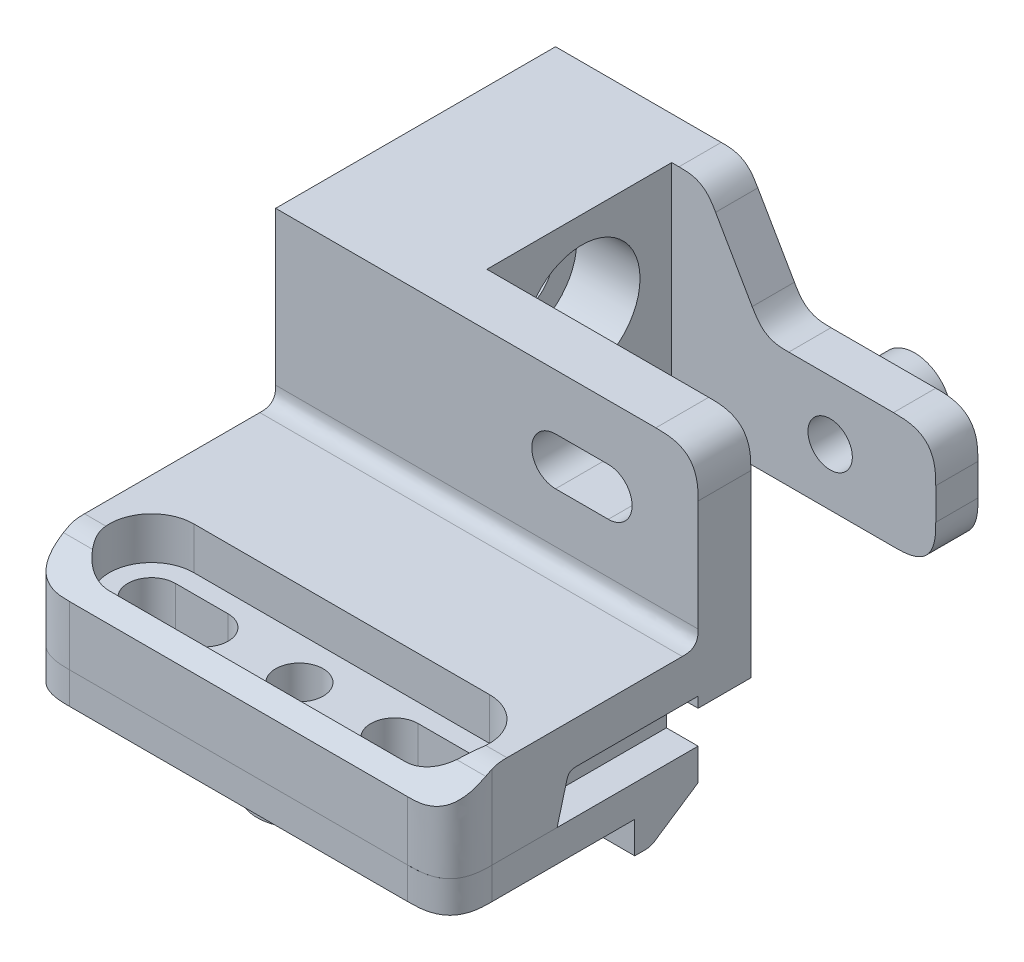
from build123d import *

# Parameters (mm, degrees)
SKETCH1_W                       = 40
SKETCH1_H                       = 35
BOSS_EXTRUDE1_DEPTH             = 3
FILLET1_SIZE                    = 4
M4X0_7_TAPPED_HOLE1_D           = 3.3
SKETCH4_W                       = 2
SKETCH4_H                       = 12.5
BOSS_EXTRUDE3_DEPTH             = 2.5
FILLET2_SIZE                    = 0.5
BOSS_EXTRUDE4_DEPTH             = 40
FILLET3_SIZE                    = 4
CBORE_FOR_M4_SHCS1_AT_2_COUNT   = 2
CBORE_FOR_M4_SHCS1_AT_2_PITCH   = 23.5
CBORE_START                     = 7.1
CBORE_SLOT_FOR_M4_SHCS1_DEPTH   = 4
CBORE_START_2                   = 3
CBORE_SLOT_FOR_M4_SHCS1_2_DEPTH = 4.1
CBORE_START_3                   = -1
CBORE_SLOT_FOR_M4_SHCS1_3_DEPTH = 5
CUT_EXTRUDE2_DEPTH              = 54.62284976
SKETCH15_W                      = 14.43925212
SKETCH15_H                      = 18.345523225
CUT_EXTRUDE3_DEPTH              = 55.297421828
BOSS_EXTRUDE5_DEPTH             = 40
BOSS_EXTRUDE6_START             = 2
SKETCH17_R                      = 4
SKETCH17_R_2                    = 1.65
BOSS_EXTRUDE6_DEPTH             = 2
SKETCH26_W                      = 40
SKETCH26_H                      = 21
BOSS_EXTRUDE9_DEPTH             = 5
BOSS_EXTRUDE10_DEPTH            = 15
FILLET19_SIZE                   = 1.5
FILLET20_SIZE                   = 4
M4_START                        = -28.5
M4_CLEARANCE_SLOT1_DEPTH        = 5
BOSS_EXTRUDE11_DEPTH            = 25
BOSS_EXTRUDE11_DEPTH_BACK       = 15
SKETCH34_W                      = 4
SKETCH34_H                      = 21
M5X0_8_TAPPED_HOLE2_AT_2_COUNT  = 2
M5X0_8_TAPPED_HOLE2_AT_2_PITCH  = 20.006249024
CUT_EXTRUDE6_DEPTH              = 4
FILLET26_SIZE                   = 4
SKETCH43_R                      = 3.5
SKETCH43_R_2                    = 2.525
BOSS_EXTRUDE12_DEPTH            = 4
SKETCH43_3_R                    = 3.5
SKETCH43_3_R_2                  = 2.525
BOSS_EXTRUDE13_DEPTH            = 2


with BuildPart() as part:
    # Sketch1 → Boss-Extrude1 (new body)
    with BuildSketch(Plane(origin=(0, 0, 0), x_dir=(1, 0, 0), z_dir=(0, 1, 0))):
        with Locations((20, 17.5)):
            Rectangle(SKETCH1_W, SKETCH1_H)
        with BuildLine():
            Line((34.5, 27.25), (28.5, 27.25))
            ThreePointArc((28.5, 27.25), (26.5, 29.25), (28.5, 31.25))
            Line((28.5, 31.25), (34.5, 31.25))
            ThreePointArc((34.5, 31.25), (36.5, 29.25), (34.5, 27.25))
        make_face(mode=Mode.SUBTRACT)
        with BuildLine():
            Line((5.5, 27.25), (11.5, 27.25))
            ThreePointArc((11.5, 27.25), (13.5, 29.25), (11.5, 31.25))
            Line((11.5, 31.25), (5.5, 31.25))
            ThreePointArc((5.5, 31.25), (3.5, 29.25), (5.5, 27.25))
        make_face(mode=Mode.SUBTRACT)
        with BuildLine():
            Line((5.5, 7.75), (11.5, 7.75))
            ThreePointArc((11.5, 7.75), (13.5, 5.75), (11.5, 3.75))
            Line((11.5, 3.75), (5.5, 3.75))
            ThreePointArc((5.5, 3.75), (3.5, 5.75), (5.5, 7.75))
        make_face(mode=Mode.SUBTRACT)
        with BuildLine():
            Line((34.5, 7.75), (28.5, 7.75))
            ThreePointArc((28.5, 7.75), (26.5, 5.75), (28.5, 3.75))
            Line((28.5, 3.75), (34.5, 3.75))
            ThreePointArc((34.5, 3.75), (36.5, 5.75), (34.5, 7.75))
        make_face(mode=Mode.SUBTRACT)
    extrude(amount=BOSS_EXTRUDE1_DEPTH)

    # Fillet1
    # a fillet whose section is not a circle: 4 mm, written as the material it takes off along each edge
    with BuildSketch(Plane(origin=(0, -10, -35), x_dir=(1, 0, 0), z_dir=(0, 1, 0)), Plane(origin=(40, -10, -35), x_dir=(0, 0, 1), z_dir=(0, 1, 0)), Plane(origin=(40, -10, 0), x_dir=(-1, 0, 0), z_dir=(0, 1, 0))) as fillet1_piece_1:
        with BuildLine():
            add(Edge.make_bspline([(FILLET1_SIZE, 0), (FILLET1_SIZE * 0.831801948466, 0), (FILLET1_SIZE * 0.663603896932, 0), (FILLET1_SIZE * 0.292893218813, -FILLET1_SIZE * 0.0716919198361), (FILLET1_SIZE * 0.0716919198361, -FILLET1_SIZE * 0.292893218813), (0, -FILLET1_SIZE * 0.663603896932), (0, -FILLET1_SIZE * 0.831801948466), (0, -FILLET1_SIZE)], knots=[0, 0, 0, 0, 0, 0, 0.5, 0.5, 1, 1, 1, 1, 1, 1], degree=5))
            Line((0, -FILLET1_SIZE), (0, 0))
            Line((0, 0), (FILLET1_SIZE, 0))
        make_face()
    extrude(amount=23, mode=Mode.SUBTRACT)
    with BuildSketch(Plane(origin=(0, -10, 0), x_dir=(1, 0, 0), z_dir=(0, 1, 0))) as fillet1_piece_2:
        with BuildLine():
            add(Edge.make_bspline([(FILLET1_SIZE, 0), (FILLET1_SIZE * 0.831801948466, 0), (FILLET1_SIZE * 0.663603896932, 0), (FILLET1_SIZE * 0.292893218813, FILLET1_SIZE * 0.0716919198361), (FILLET1_SIZE * 0.0716919198361, FILLET1_SIZE * 0.292893218813), (0, FILLET1_SIZE * 0.663603896932), (0, FILLET1_SIZE * 0.831801948466), (0, FILLET1_SIZE)], knots=[0, 0, 0, 0, 0, 0, 0.5, 0.5, 1, 1, 1, 1, 1, 1], degree=5))
            Line((0, FILLET1_SIZE), (0, 0))
            Line((0, 0), (FILLET1_SIZE, 0))
        make_face()
    extrude(amount=23, mode=Mode.SUBTRACT)

    # M4x0.7 Tapped Hole1 (through all)
    with Locations(Plane(origin=(0, 3, 0), x_dir=(1, 0, 0), z_dir=(0, 1, 0))):
        with Locations((20, 29.25), (20, 5.75)):
            Hole(M4X0_7_TAPPED_HOLE1_D / 2)

    # Sketch4 → Boss-Extrude3 (add)
    with BuildSketch(Plane(origin=(0, 3, 0), x_dir=(1, 0, 0), z_dir=(0, 1, 0))):
        with Locations((1, 17.5)):
            Rectangle(SKETCH4_W, SKETCH4_H)
        with Locations((6.833333333, 17.5)):
            Rectangle(SKETCH4_W, SKETCH4_H)
        with Locations((12.666666667, 17.5)):
            Rectangle(SKETCH4_W, SKETCH4_H)
        with Locations((18.5, 17.5)):
            Rectangle(SKETCH4_W, SKETCH4_H)
        with Locations((24.333333333, 17.5)):
            Rectangle(SKETCH4_W, SKETCH4_H)
        with Locations((30.166666667, 17.5)):
            Rectangle(SKETCH4_W, SKETCH4_H)
        with Locations((36, 17.5)):
            Rectangle(SKETCH4_W, SKETCH4_H)
    extrude(amount=BOSS_EXTRUDE3_DEPTH)

    # Fillet2
    # a fillet whose section is not a circle: 0.5 mm, written as the material it adds along each edge
    with BuildSketch(Plane(origin=(2, 3, -11.25), x_dir=(0, 0, 1), z_dir=(-1, 0, 0)), Plane(origin=(0, 3, -23.75), x_dir=(0, 0, -1), z_dir=(1, 0, 0))) as fillet2_piece_1:
        with BuildLine():
            add(Edge.make_bspline([(FILLET2_SIZE, 0), (FILLET2_SIZE * 0.831801948466, 0), (FILLET2_SIZE * 0.663603896932, 0), (FILLET2_SIZE * 0.292893218813, FILLET2_SIZE * 0.0716919198361), (FILLET2_SIZE * 0.0716919198361, FILLET2_SIZE * 0.292893218813), (0, FILLET2_SIZE * 0.663603896932), (0, FILLET2_SIZE * 0.831801948466), (0, FILLET2_SIZE)], knots=[0, 0, 0, 0, 0, 0, 0.5, 0.5, 1, 1, 1, 1, 1, 1], degree=5))
            Line((0, FILLET2_SIZE), (0, 0))
            Line((0, 0), (FILLET2_SIZE, 0))
        make_face()
    extrude(amount=2)
    with BuildSketch(Plane(origin=(7.833333333, 3, -23.75), x_dir=(0, 0, -1), z_dir=(-1, 0, 0)), Plane(origin=(5.833333333, 3, -11.25), x_dir=(0, 0, 1), z_dir=(1, 0, 0)), Plane(origin=(13.666666667, 3, -23.75), x_dir=(0, 0, -1), z_dir=(-1, 0, 0)), Plane(origin=(11.666666667, 3, -11.25), x_dir=(0, 0, 1), z_dir=(1, 0, 0)), Plane(origin=(17.5, 3, -11.25), x_dir=(0, 0, 1), z_dir=(1, 0, 0)), Plane(origin=(25.333333333, 3, -23.75), x_dir=(0, 0, -1), z_dir=(-1, 0, 0)), Plane(origin=(23.333333333, 3, -11.25), x_dir=(0, 0, 1), z_dir=(1, 0, 0)), Plane(origin=(31.166666667, 3, -23.75), x_dir=(0, 0, -1), z_dir=(-1, 0, 0)), Plane(origin=(29.166666667, 3, -11.25), x_dir=(0, 0, 1), z_dir=(1, 0, 0)), Plane(origin=(37, 3, -23.75), x_dir=(0, 0, -1), z_dir=(-1, 0, 0)), Plane(origin=(35, 3, -11.25), x_dir=(0, 0, 1), z_dir=(1, 0, 0)), Plane(origin=(19.5, 3, -23.75), x_dir=(0, 0, -1), z_dir=(-1, 0, 0))) as fillet2_piece_2:
        with BuildLine():
            add(Edge.make_bspline([(FILLET2_SIZE, 0), (FILLET2_SIZE * 0.831801948466, 0), (FILLET2_SIZE * 0.663603896932, 0), (FILLET2_SIZE * 0.292893218813, -FILLET2_SIZE * 0.0716919198361), (FILLET2_SIZE * 0.0716919198361, -FILLET2_SIZE * 0.292893218813), (0, -FILLET2_SIZE * 0.663603896932), (0, -FILLET2_SIZE * 0.831801948466), (0, -FILLET2_SIZE)], knots=[0, 0, 0, 0, 0, 0, 0.5, 0.5, 1, 1, 1, 1, 1, 1], degree=5))
            Line((0, -FILLET2_SIZE), (0, 0))
            Line((0, 0), (FILLET2_SIZE, 0))
        make_face()
    extrude(amount=2)
    # a fillet whose section is not a circle: 0.5 mm, written as the material it takes off along each edge
    with BuildSketch(Plane(origin=(-1.25, 5.5, -23.75), x_dir=(0, 0, 1), z_dir=(1, 0, 0)), Plane(origin=(4.583333333, 5.5, -11.25), x_dir=(0, -1, 0), z_dir=(1, 0, 0)), Plane(origin=(10.416666667, 5.5, -11.25), x_dir=(0, -1, 0), z_dir=(1, 0, 0)), Plane(origin=(16.25, 5.5, -11.25), x_dir=(0, -1, 0), z_dir=(1, 0, 0)), Plane(origin=(22.083333333, 5.5, -11.25), x_dir=(0, -1, 0), z_dir=(1, 0, 0)), Plane(origin=(27.916666667, 5.5, -11.25), x_dir=(0, -1, 0), z_dir=(1, 0, 0)), Plane(origin=(33.75, 5.5, -11.25), x_dir=(0, -1, 0), z_dir=(1, 0, 0))) as fillet2_2_piece_1:
        with BuildLine():
            add(Edge.make_bspline([(FILLET2_SIZE, 0), (FILLET2_SIZE * 0.831801948466, 0), (FILLET2_SIZE * 0.663603896932, 0), (FILLET2_SIZE * 0.292893218813, FILLET2_SIZE * 0.0716919198361), (FILLET2_SIZE * 0.0716919198361, FILLET2_SIZE * 0.292893218813), (0, FILLET2_SIZE * 0.663603896932), (0, FILLET2_SIZE * 0.831801948466), (0, FILLET2_SIZE)], knots=[0, 0, 0, 0, 0, 0, 0.5, 0.5, 1, 1, 1, 1, 1, 1], degree=5))
            Line((0, FILLET2_SIZE), (0, 0))
            Line((0, 0), (FILLET2_SIZE, 0))
        make_face()
    extrude(amount=4.5, mode=Mode.SUBTRACT)
    with BuildSketch(Plane(origin=(3.25, 5.5, -11.25), x_dir=(0, -1, 0), z_dir=(-1, 0, 0)), Plane(origin=(9.083333333, 5.5, -23.75), x_dir=(0, 0, 1), z_dir=(-1, 0, 0)), Plane(origin=(14.916666667, 5.5, -23.75), x_dir=(0, 0, 1), z_dir=(-1, 0, 0)), Plane(origin=(26.583333333, 5.5, -23.75), x_dir=(0, 0, 1), z_dir=(-1, 0, 0)), Plane(origin=(32.416666667, 5.5, -23.75), x_dir=(0, 0, 1), z_dir=(-1, 0, 0)), Plane(origin=(38.25, 5.5, -23.75), x_dir=(0, 0, 1), z_dir=(-1, 0, 0)), Plane(origin=(20.75, 5.5, -23.75), x_dir=(0, 0, 1), z_dir=(-1, 0, 0))) as fillet2_2_piece_2:
        with BuildLine():
            add(Edge.make_bspline([(FILLET2_SIZE, 0), (FILLET2_SIZE * 0.831801948466, 0), (FILLET2_SIZE * 0.663603896932, 0), (FILLET2_SIZE * 0.292893218813, -FILLET2_SIZE * 0.0716919198361), (FILLET2_SIZE * 0.0716919198361, -FILLET2_SIZE * 0.292893218813), (0, -FILLET2_SIZE * 0.663603896932), (0, -FILLET2_SIZE * 0.831801948466), (0, -FILLET2_SIZE)], knots=[0, 0, 0, 0, 0, 0, 0.5, 0.5, 1, 1, 1, 1, 1, 1], degree=5))
            Line((0, -FILLET2_SIZE), (0, 0))
            Line((0, 0), (FILLET2_SIZE, 0))
        make_face()
    extrude(amount=4.5, mode=Mode.SUBTRACT)

    # CBORE SLOT for M4 SHCS1 3 outline → CBORE SLOT for M4 SHCS1 3 (cut)
    with BuildSketch(Plane(origin=(0, 0, 0), x_dir=(1, 0, 0), z_dir=(0, 1, 0)).offset(CBORE_START_3)):
        with BuildLine():
            Line((34, 8), (29, 8))
            ThreePointArc((29, 8), (28.310590421, 7.891778334), (27.6875, 7.57752394))
            ThreePointArc((27.6875, 7.57752394), (28.084697628, 7.706405873), (28.5, 7.75))
            Line((28.5, 7.75), (34.5, 7.75))
            ThreePointArc((34.5, 7.75), (34.915302372, 7.706405873), (35.3125, 7.57752394))
            ThreePointArc((35.3125, 7.57752394), (34.689409579, 7.891778334), (34, 8))
        make_face()
        with BuildLine():
            ThreePointArc((28.5, 3.75), (28.084697628, 3.793594127), (27.6875, 3.92247606))
            ThreePointArc((27.6875, 3.92247606), (28.310590421, 3.608221666), (29, 3.5))
            Line((29, 3.5), (34, 3.5))
            ThreePointArc((34, 3.5), (34.689409579, 3.608221666), (35.3125, 3.92247606))
            ThreePointArc((35.3125, 3.92247606), (34.915302372, 3.793594127), (34.5, 3.75))
            Line((34.5, 3.75), (28.5, 3.75))
        make_face()
        with BuildLine():
            ThreePointArc((12.3125, 7.57752394), (11.689409579, 7.891778334), (11, 8))
            Line((11, 8), (6, 8))
            ThreePointArc((6, 8), (5.310590421, 7.891778334), (4.6875, 7.57752394))
            ThreePointArc((4.6875, 7.57752394), (5.084697628, 7.706405873), (5.5, 7.75))
            Line((5.5, 7.75), (11.5, 7.75))
            ThreePointArc((11.5, 7.75), (11.915302372, 7.706405873), (12.3125, 7.57752394))
        make_face()
        with BuildLine():
            ThreePointArc((11, 3.5), (11.689409579, 3.608221666), (12.3125, 3.92247606))
            ThreePointArc((12.3125, 3.92247606), (11.915302372, 3.793594127), (11.5, 3.75))
            Line((11.5, 3.75), (5.5, 3.75))
            ThreePointArc((5.5, 3.75), (5.084697628, 3.793594127), (4.6875, 3.92247606))
            ThreePointArc((4.6875, 3.92247606), (5.310590421, 3.608221666), (6, 3.5))
            Line((6, 3.5), (11, 3.5))
        make_face()
        with BuildLine():
            Line((34, 31.5), (29, 31.5))
            ThreePointArc((29, 31.5), (28.310590421, 31.391778334), (27.6875, 31.07752394))
            ThreePointArc((27.6875, 31.07752394), (28.084697628, 31.206405873), (28.5, 31.25))
            Line((28.5, 31.25), (34.5, 31.25))
            ThreePointArc((34.5, 31.25), (34.915302372, 31.206405873), (35.3125, 31.07752394))
            ThreePointArc((35.3125, 31.07752394), (34.689409579, 31.391778334), (34, 31.5))
        make_face()
        with BuildLine():
            ThreePointArc((28.5, 27.25), (28.084697628, 27.293594127), (27.6875, 27.42247606))
            ThreePointArc((27.6875, 27.42247606), (28.310590421, 27.108221666), (29, 27))
            Line((29, 27), (34, 27))
            ThreePointArc((34, 27), (34.689409579, 27.108221666), (35.3125, 27.42247606))
            ThreePointArc((35.3125, 27.42247606), (34.915302372, 27.293594127), (34.5, 27.25))
            Line((34.5, 27.25), (28.5, 27.25))
        make_face()
        with BuildLine():
            ThreePointArc((12.3125, 31.07752394), (11.689409579, 31.391778334), (11, 31.5))
            Line((11, 31.5), (6, 31.5))
            ThreePointArc((6, 31.5), (5.310590421, 31.391778334), (4.6875, 31.07752394))
            ThreePointArc((4.6875, 31.07752394), (5.084697628, 31.206405873), (5.5, 31.25))
            Line((5.5, 31.25), (11.5, 31.25))
            ThreePointArc((11.5, 31.25), (11.915302372, 31.206405873), (12.3125, 31.07752394))
        make_face()
        with BuildLine():
            ThreePointArc((11, 27), (11.689409579, 27.108221666), (12.3125, 27.42247606))
            ThreePointArc((12.3125, 27.42247606), (11.915302372, 27.293594127), (11.5, 27.25))
            Line((11.5, 27.25), (5.5, 27.25))
            ThreePointArc((5.5, 27.25), (5.084697628, 27.293594127), (4.6875, 27.42247606))
            ThreePointArc((4.6875, 27.42247606), (5.310590421, 27.108221666), (6, 27))
            Line((6, 27), (11, 27))
        make_face()
    extrude(amount=CBORE_SLOT_FOR_M4_SHCS1_3_DEPTH, mode=Mode.SUBTRACT)


with BuildPart() as body_2:
    # Sketch7 → Boss-Extrude4 (new body)
    with BuildSketch(Plane.ZY):
        Polygon((-11.25, 7.1), (-23.75, 7.1), (-24.848591689, 3), (-35, 3), (-35, 8.6), (-30.669872981, 11.1), (-4.330127019, 11.1), (0, 8.6), (0, 3), (-10.151408311, 3), align=None)
    extrude(amount=-BOSS_EXTRUDE4_DEPTH)

    # Fillet3
    # a fillet whose section is not a circle: 4 mm, written as the material it takes off along each edge
    with BuildSketch(Plane(origin=(0, -7, -35), x_dir=(1, 0, 0), z_dir=(0, 1, 0)), Plane(origin=(0, 18.6, 0), x_dir=(1, 0, 0), z_dir=(0, -1, 0))) as fillet3_piece_1:
        with BuildLine():
            add(Edge.make_bspline([(FILLET3_SIZE, 0), (FILLET3_SIZE * 0.831801948466, 0), (FILLET3_SIZE * 0.663603896932, 0), (FILLET3_SIZE * 0.292893218813, -FILLET3_SIZE * 0.0716919198361), (FILLET3_SIZE * 0.0716919198361, -FILLET3_SIZE * 0.292893218813), (0, -FILLET3_SIZE * 0.663603896932), (0, -FILLET3_SIZE * 0.831801948466), (0, -FILLET3_SIZE)], knots=[0, 0, 0, 0, 0, 0, 0.5, 0.5, 1, 1, 1, 1, 1, 1], degree=5))
            Line((0, -FILLET3_SIZE), (0, 0))
            Line((0, 0), (FILLET3_SIZE, 0))
        make_face()
    extrude(amount=25.6, mode=Mode.SUBTRACT)
    with BuildSketch(Plane(origin=(40, 18.6, 0), x_dir=(-1, 0, 0), z_dir=(0, -1, 0)), Plane(origin=(40, -7, -35), x_dir=(-1, 0, 0), z_dir=(0, 1, 0))) as fillet3_piece_2:
        with BuildLine():
            add(Edge.make_bspline([(FILLET3_SIZE, 0), (FILLET3_SIZE * 0.831801948466, 0), (FILLET3_SIZE * 0.663603896932, 0), (FILLET3_SIZE * 0.292893218813, FILLET3_SIZE * 0.0716919198361), (FILLET3_SIZE * 0.0716919198361, FILLET3_SIZE * 0.292893218813), (0, FILLET3_SIZE * 0.663603896932), (0, FILLET3_SIZE * 0.831801948466), (0, FILLET3_SIZE)], knots=[0, 0, 0, 0, 0, 0, 0.5, 0.5, 1, 1, 1, 1, 1, 1], degree=5))
            Line((0, FILLET3_SIZE), (0, 0))
            Line((0, 0), (FILLET3_SIZE, 0))
        make_face()
    extrude(amount=25.6, mode=Mode.SUBTRACT)

    # Fillet4
    # a fillet whose section is not a circle: 4 mm, written as the material it takes off along each edge
    with BuildSketch(Plane(origin=(-2.679491924, 11.1, -4.330127019), x_dir=(0, -0.4999999999999976, 0.8660254037844402), z_dir=(1, 0, 0)), Plane(origin=(-2.679491924, 11.1, -30.669872981), x_dir=(0, 0, 1), z_dir=(1, 0, 0))) as fillet4_piece_1:
        with BuildLine():
            add(Edge.make_bspline([(1.07179677, 0), (0.872924764, 0), (0.674052759, 0), (0.23110286, 0.023954568), (-0.188163664, 0.136296695), (-0.583746812, 0.337026379), (-0.755975021, 0.436462382), (-0.92820323, 0.535898385)], knots=[0, 0, 0, 0, 0, 0, 0.5, 0.5, 1, 1, 1, 1, 1, 1], degree=5))
            Line((-0.92820323, 0.535898385), (0, 0))
            Line((0, 0), (1.07179677, 0))
        make_face()
    extrude(amount=45.358983849, mode=Mode.SUBTRACT)

    # Sketch9 → CBORE for M4 SHCS1 (revolve, cut)
    with BuildSketch(Plane(origin=(20, 11.1, -5.75), x_dir=(0, 0, 1), z_dir=(1, 0, 0))):
        Polygon((0, 0), (0, 11.15), (2.25, 11.15), (2.25, 4), (4, 4), (4, 0), align=None)
    cbore_for_m4_shcs1 = revolve(axis=Axis((20, 17.45, -5.75), (0, -1, 0)), mode=Mode.SUBTRACT)

    # CBORE for M4 SHCS1 at 2: CBORE for M4 SHCS1 ×2
    with Locations(*[(0, 0, -i * CBORE_FOR_M4_SHCS1_AT_2_PITCH) for i in range(1, CBORE_FOR_M4_SHCS1_AT_2_COUNT)]):
        add(cbore_for_m4_shcs1, mode=Mode.SUBTRACT)

    # CBORE SLOT for M4 SHCS1: read off the stored shape, not the designer's step
    # CBORE SLOT for M4 SHCS1 outline → CBORE SLOT for M4 SHCS1 (cut)
    with BuildSketch(Plane(origin=(0, 0, 0), x_dir=(1, 0, 0), z_dir=(0, 1, 0)).offset(CBORE_START)):
        with BuildLine():
            Line((29, 1.75), (34, 1.75))
            ThreePointArc((34, 1.75), (38, 5.75), (34, 9.75))
            Line((34, 9.75), (29, 9.75))
            ThreePointArc((29, 9.75), (25, 5.75), (29, 1.75))
        make_face()
        with BuildLine():
            ThreePointArc((11, 1.75), (15, 5.75), (11, 9.75))
            Line((11, 9.75), (6, 9.75))
            ThreePointArc((6, 9.75), (2, 5.75), (6, 1.75))
            Line((6, 1.75), (11, 1.75))
        make_face()
        with BuildLine():
            Line((29, 25.25), (34, 25.25))
            ThreePointArc((34, 25.25), (38, 29.25), (34, 33.25))
            Line((34, 33.25), (29, 33.25))
            ThreePointArc((29, 33.25), (25, 29.25), (29, 25.25))
        make_face()
        with BuildLine():
            ThreePointArc((11, 25.25), (15, 29.25), (11, 33.25))
            Line((11, 33.25), (6, 33.25))
            ThreePointArc((6, 33.25), (2, 29.25), (6, 25.25))
            Line((6, 25.25), (11, 25.25))
        make_face()
    extrude(amount=CBORE_SLOT_FOR_M4_SHCS1_DEPTH, mode=Mode.SUBTRACT)

    # CBORE SLOT for M4 SHCS1 2 outline → CBORE SLOT for M4 SHCS1 2 (cut)
    with BuildSketch(Plane(origin=(0, 0, 0), x_dir=(1, 0, 0), z_dir=(0, 1, 0)).offset(CBORE_START_2)):
        with BuildLine():
            Line((29, 3.5), (34, 3.5))
            ThreePointArc((34, 3.5), (36.25, 5.75), (34, 8))
            Line((34, 8), (29, 8))
            ThreePointArc((29, 8), (26.75, 5.75), (29, 3.5))
        make_face()
        with BuildLine():
            ThreePointArc((11, 3.5), (13.25, 5.75), (11, 8))
            Line((11, 8), (6, 8))
            ThreePointArc((6, 8), (3.75, 5.75), (6, 3.5))
            Line((6, 3.5), (11, 3.5))
        make_face()
        with BuildLine():
            Line((29, 27), (34, 27))
            ThreePointArc((34, 27), (36.25, 29.25), (34, 31.5))
            Line((34, 31.5), (29, 31.5))
            ThreePointArc((29, 31.5), (26.75, 29.25), (29, 27))
        make_face()
        with BuildLine():
            ThreePointArc((11, 27), (13.25, 29.25), (11, 31.5))
            Line((11, 31.5), (6, 31.5))
            ThreePointArc((6, 31.5), (3.75, 29.25), (6, 27))
            Line((6, 27), (11, 27))
        make_face()
    extrude(amount=CBORE_SLOT_FOR_M4_SHCS1_2_DEPTH, mode=Mode.SUBTRACT)

    # Sketch14 → Cut-Extrude2 (cut, through all)
    with BuildSketch(Plane(origin=(0, 7.1, 0), x_dir=(1, 0, 0), z_dir=(0, 1, 0))):
        with BuildLine():
            Line((6, 9.75), (34, 9.75))
            ThreePointArc((34, 9.75), (38, 5.75), (34, 1.75))
            Line((34, 1.75), (6, 1.75))
            ThreePointArc((6, 1.75), (2, 5.75), (6, 9.75))
        make_face()
        with BuildLine():
            Line((6, 25.25), (34, 25.25))
            ThreePointArc((34, 25.25), (38, 29.25), (34, 33.25))
            Line((34, 33.25), (6, 33.25))
            ThreePointArc((6, 33.25), (2, 29.25), (6, 25.25))
        make_face()
    extrude(amount=CUT_EXTRUDE2_DEPTH, mode=Mode.SUBTRACT)


with BuildPart() as cut_extrude3_tool:
    # Sketch15 → Cut-Extrude3 (new, through all)
    with BuildSketch(Plane(origin=(40, 0, 0), x_dir=(0, 0, -1), z_dir=(1, 0, 0))):
        with Locations((30.71962606, 7.319913379)):
            Rectangle(SKETCH15_W, SKETCH15_H)
    extrude(amount=-CUT_EXTRUDE3_DEPTH)


with BuildPart() as part_1:
    add(part.part)

    # Cut-Extrude3: cut by cut_extrude3_tool
    add(cut_extrude3_tool.part, mode=Mode.SUBTRACT)

    # Sketch16 → Boss-Extrude5 (add)
    with BuildSketch(Plane(origin=(40, 0, 0), x_dir=(0, 0, -1), z_dir=(1, 0, 0))):
        Polygon((17.5, -3), (17.5, 0), (23.5, 0), (19, -3), align=None)
    extrude(amount=-BOSS_EXTRUDE5_DEPTH)

    # Fillet9
    # a fillet whose section is not a circle: 2 mm, written as the material it takes off along each edge
    with BuildSketch(Plane(origin=(41.513878189, -3, -19), x_dir=(0, 0.5547001962264975, -0.8320502943369983), z_dir=(-1, 0, 0))) as fillet9_piece_1:
        with BuildLine():
            add(Edge.make_bspline([(0.605551275, 0), (0.493503997, 0), (0.381456719, 0), (0.131780037, -0.015284575), (-0.101169262, -0.085815947), (-0.317391175, -0.211594117), (-0.410620146, -0.273746764), (-0.503849117, -0.335899411)], knots=[0, 0, 0, 0, 0, 0, 0.5, 0.5, 1, 1, 1, 1, 1, 1], degree=5))
            Line((-0.503849117, -0.335899411), (0, 0))
            Line((0, 0), (0.605551275, 0))
        make_face()
    extrude(amount=43.027756377, mode=Mode.SUBTRACT)

    # Sketch17 → Boss-Extrude6 (add)
    with BuildSketch(Plane.XZ.offset(BOSS_EXTRUDE6_START)):
        with Locations(Location((20, -5.75, 0), (0, 0, 270))):
            Circle(SKETCH17_R)
        with Locations(Location((20, -5.75, 0), (0, 0, 90))):
            Circle(SKETCH17_R_2, mode=Mode.SUBTRACT)
    extrude(amount=-BOSS_EXTRUDE6_DEPTH)


with BuildPart() as body_2_1:
    add(body_2.part)

    # Cut-Extrude3: cut by cut_extrude3_tool
    add(cut_extrude3_tool.part, mode=Mode.SUBTRACT)

    # Fillet6
    # a fillet whose section is not a circle: 1 mm, written as the material it adds along each edge
    with BuildSketch(Plane(origin=(0, 7.1, -11.25), x_dir=(0, 0, -1), z_dir=(1, 0, 0))) as fillet6_piece_1:
        with BuildLine():
            add(Edge.make_bspline([(0.767326988, 0), (0.633400256, 0), (0.499473523, 0), (0.201656646, -0.045828534), (-0.007925615, -0.20664666), (-0.12927326, -0.482454376), (-0.163936049, -0.611817665), (-0.198598838, -0.741180955)], knots=[0, 0, 0, 0, 0, 0, 0.5, 0.5, 1, 1, 1, 1, 1, 1], degree=5))
            Line((-0.198598838, -0.741180955), (0, 0))
            Line((0, 0), (0.767326988, 0))
        make_face()
    extrude(amount=40)

    # Sketch26 → Boss-Extrude9 (add)
    with BuildSketch(Plane(origin=(0, 0, -23.5), x_dir=(-1, 0, 0), z_dir=(0, 0, -1))):
        with Locations((-20, 16.6)):
            Rectangle(SKETCH26_W, SKETCH26_H)
    extrude(amount=BOSS_EXTRUDE9_DEPTH)

    # Sketch28 → Boss-Extrude10 (add)
    with BuildSketch(Plane(origin=(0, 0, 0), x_dir=(0, 0, -1), z_dir=(1, 0, 0))):
        Polygon((37.5, 27.1), (28.5, 27.1), (28.5, 6.1), (37.5, 6.1), (46, 6.1), (46, 27.1), align=None)
    extrude(amount=BOSS_EXTRUDE10_DEPTH)

    # Sketch30 → CBORE for M6 SHCS1 (revolve, cut)
    with BuildSketch(Plane(origin=(15, 19.1, -37.5), x_dir=(0, 0, -1), z_dir=(0, 1, 0))):
        Polygon((0, 0), (0, 15.060298628), (3.3, 15.060298628), (3.3, 6), (5.5, 6), (5.5, 0), align=None)
    revolve(axis=Axis((21.35, 19.1, -37.5), (-1, 0, 0)), mode=Mode.SUBTRACT)

    # Fillet19
    # a fillet whose section is not a circle: 1.5 mm, written as the material it adds along each edge
    with BuildSketch(Plane(origin=(0, 11.1, -23.5), x_dir=(0, 1, 0), z_dir=(1, 0, 0))) as fillet19_piece_1:
        with BuildLine():
            add(Edge.make_bspline([(FILLET19_SIZE, 0), (FILLET19_SIZE * 0.831801948466, 0), (FILLET19_SIZE * 0.663603896932, 0), (FILLET19_SIZE * 0.292893218813, FILLET19_SIZE * 0.0716919198361), (FILLET19_SIZE * 0.0716919198361, FILLET19_SIZE * 0.292893218813), (0, FILLET19_SIZE * 0.663603896932), (0, FILLET19_SIZE * 0.831801948466), (0, FILLET19_SIZE)], knots=[0, 0, 0, 0, 0, 0, 0.5, 0.5, 1, 1, 1, 1, 1, 1], degree=5))
            Line((0, FILLET19_SIZE), (-FILLET19_SIZE * 0.02, FILLET19_SIZE))
            Line((-FILLET19_SIZE * 0.02, FILLET19_SIZE), (-FILLET19_SIZE * 0.02, -FILLET19_SIZE * 0.02))
            Line((-FILLET19_SIZE * 0.02, -FILLET19_SIZE * 0.02), (FILLET19_SIZE, -FILLET19_SIZE * 0.02))
            Line((FILLET19_SIZE, -FILLET19_SIZE * 0.02), (FILLET19_SIZE, 0))
        make_face()
    extrude(amount=40)

    # Fillet20
    # a fillet whose section is not a circle: 4 mm, written as the material it takes off along each edge
    with BuildSketch(Plane(origin=(40, 27.1, -13.5), x_dir=(0, -1, 0), z_dir=(0, 0, -1))) as fillet20_piece_1:
        with BuildLine():
            add(Edge.make_bspline([(FILLET20_SIZE, 0), (FILLET20_SIZE * 0.831801948466, 0), (FILLET20_SIZE * 0.663603896932, 0), (FILLET20_SIZE * 0.292893218813, FILLET20_SIZE * 0.0716919198361), (FILLET20_SIZE * 0.0716919198361, FILLET20_SIZE * 0.292893218813), (0, FILLET20_SIZE * 0.663603896932), (0, FILLET20_SIZE * 0.831801948466), (0, FILLET20_SIZE)], knots=[0, 0, 0, 0, 0, 0, 0.5, 0.5, 1, 1, 1, 1, 1, 1], degree=5))
            Line((0, FILLET20_SIZE), (0, 0))
            Line((0, 0), (FILLET20_SIZE, 0))
        make_face()
    extrude(amount=25, mode=Mode.SUBTRACT)

    # M4 Clearance Slot1: read off the stored shape, not the designer's step
    # M4 Clearance Slot1 outline → M4 Clearance Slot1 (cut)
    with BuildSketch(Plane.XY.offset(M4_START)):
        with BuildLine():
            ThreePointArc((31.5, 17.35), (33.75, 19.6), (31.5, 21.85))
            Line((31.5, 21.85), (26.5, 21.85))
            ThreePointArc((26.5, 21.85), (24.25, 19.6), (26.5, 17.35))
            Line((26.5, 17.35), (31.5, 17.35))
        make_face()
    extrude(amount=M4_CLEARANCE_SLOT1_DEPTH, mode=Mode.SUBTRACT)

    # M4 Clearance Slot1 2: loft between two sections, ruled curve by curve
    m4_clearance_slot1_2_from = [
        Edge.make_three_point_arc((31.5, 21.85, -28.475), (33.090990258, 21.190990258, -28.475), (33.75, 19.6, -28.475)),
        Edge.make_three_point_arc((33.75, 19.6, -28.475), (33.090990258, 18.009009742, -28.475), (31.5, 17.35, -28.475)),
        Edge.make_three_point_arc((26.5, 17.35, -28.475), (24.909009742, 18.009009742, -28.475), (24.25, 19.6, -28.475)),
        Edge.make_three_point_arc((24.25, 19.6, -28.475), (24.909009742, 21.190990258, -28.475), (26.5, 21.85, -28.475)),
        Edge.make_line((31.5, 17.35, -28.475), (26.5, 17.35, -28.475)),
        Edge.make_line((31.5, 21.85, -28.475), (26.5, 21.85, -28.475)),
    ]
    m4_clearance_slot1_2_to = [
        Edge.make_three_point_arc((31.5, 21.875, -28.5), (33.108667927, 21.208667927, -28.5), (33.775, 19.6, -28.5)),
        Edge.make_three_point_arc((33.775, 19.6, -28.5), (33.108667927, 17.991332073, -28.5), (31.5, 17.325, -28.5)),
        Edge.make_three_point_arc((26.5, 17.325, -28.5), (24.891332073, 17.991332073, -28.5), (24.225, 19.6, -28.5)),
        Edge.make_three_point_arc((24.225, 19.6, -28.5), (24.891332073, 21.208667927, -28.5), (26.5, 21.875, -28.5)),
        Edge.make_line((31.5, 17.325, -28.5), (26.5, 17.325, -28.5)),
        Edge.make_line((31.5, 21.875, -28.5), (26.5, 21.875, -28.5)),
    ]
    m4_clearance_slot1_2 = Solid(Shell([*[Face.make_surface_from_curves(m4_clearance_slot1_2_from[k], m4_clearance_slot1_2_to[k]) for k in range(6)], Face(Wire(m4_clearance_slot1_2_from)), Face(Wire(m4_clearance_slot1_2_to))]))
    add(m4_clearance_slot1_2, mode=Mode.SUBTRACT)

    # Sketch34 → Boss-Extrude11 (add, two sides: drawn at the far end of the back side and taken through both)
    with BuildSketch(Plane(origin=(15, 0, 0), x_dir=(0, 0, -1), z_dir=(1, 0, 0)).offset(-BOSS_EXTRUDE11_DEPTH_BACK)):
        with Locations((48, 16.6)):
            Rectangle(SKETCH34_W, SKETCH34_H)
    extrude(amount=BOSS_EXTRUDE11_DEPTH + BOSS_EXTRUDE11_DEPTH_BACK)

    # Sketch39 → M5x0.8 Tapped Hole2 (revolve, cut)
    with BuildSketch(Plane(origin=(10, 12, -50), x_dir=(0, 1, 0), z_dir=(1, 0, 0))):
        Polygon((0, 0), (0, 7.2618073), (2.1, 6), (2.1, 0.425), (2.525, 0), align=None)
    m5x0_8_tapped_hole2 = revolve(axis=Axis((10, 12, -56.35), (0, 0, 1)), mode=Mode.SUBTRACT)

    # M5x0.8 Tapped Hole2 at 2: M5x0.8 Tapped Hole2 ×2
    with Locations(*[Vector(0.9996876464082132, -0.02499219115658613, 0) * (i * M5X0_8_TAPPED_HOLE2_AT_2_PITCH) for i in range(1, M5X0_8_TAPPED_HOLE2_AT_2_COUNT)]):
        add(m5x0_8_tapped_hole2, mode=Mode.SUBTRACT)

    # Sketch41 → Cut-Extrude6 (cut)
    with BuildSketch(Plane(origin=(0, 0, -46), x_dir=(-1, 0, 0), z_dir=(0, 0, -1))):
        Polygon((-18, 27.1), (-23.773502692, 17.1), (-40, 17.1), (-40, 27.1), align=None)
    extrude(amount=CUT_EXTRUDE6_DEPTH, mode=Mode.SUBTRACT)

    # Fillet26
    # a fillet whose section is not a circle: 4 mm, written as the material it adds along each edge
    with BuildSketch(Plane(origin=(23.773502692, 17.1, -46), x_dir=(-0.4999999999999971, 0.8660254037844403, 0), z_dir=(0, 0, -1))) as fillet26_piece_1:
        with BuildLine():
            add(Edge.make_bspline([(2.309401077, 0), (1.895041723, 0), (1.480682369, 0), (0.556181472, 0.108462203), (-0.184159713, 0.535898385), (-0.740341184, 1.282308546), (-0.947520861, 1.641154273), (-1.154700538, 2)], knots=[0, 0, 0, 0, 0, 0, 0.5, 0.5, 1, 1, 1, 1, 1, 1], degree=5))
            Line((-1.154700538, 2), (0, 0))
            Line((0, 0), (2.309401077, 0))
        make_face()
    extrude(amount=4)
    # a fillet whose section is not a circle: 4 mm, written as the material it takes off along each edge
    with BuildSketch(Plane(origin=(40, 17.1, -36), x_dir=(0, -1, 0), z_dir=(0, 0, -1))) as fillet26_2_piece_1:
        with BuildLine():
            add(Edge.make_bspline([(FILLET26_SIZE, 0), (3.327207794, 0), (2.654415588, 0), (1.171572875, 0.286767679), (0.286767679, 1.171572875), (0, 2.654415588), (0, 3.327207794), (0, FILLET26_SIZE)], knots=[0, 0, 0, 0, 0, 0, 0.5, 0.5, 1, 1, 1, 1, 1, 1], degree=5))
            Line((0, FILLET26_SIZE), (0, 0))
            Line((0, 0), (FILLET26_SIZE, 0))
        make_face()
    extrude(amount=24, mode=Mode.SUBTRACT)
    with BuildSketch(Plane(origin=(18, 27.1, -40.226497308), x_dir=(-1, 0, 0), z_dir=(0, 0, -1))) as fillet26_2_piece_2:
        with BuildLine():
            add(Edge.make_bspline([(2.309401077, 0), (1.895041723, 0), (1.480682369, 0), (0.556181472, -0.108462203), (-0.184159713, -0.535898385), (-0.740341184, -1.282308546), (-0.947520861, -1.641154273), (-1.154700538, -2)], knots=[0, 0, 0, 0, 0, 0, 0.5, 0.5, 1, 1, 1, 1, 1, 1], degree=5))
            Line((-1.154700538, -2), (0, 0))
            Line((0, 0), (2.309401077, 0))
        make_face()
    extrude(amount=15.547005384, mode=Mode.SUBTRACT)
    with BuildSketch(Plane(origin=(40, 6.1, -60), x_dir=(-1, 0, 0), z_dir=(0, 0, 1))) as fillet26_2_piece_3:
        with BuildLine():
            add(Edge.make_bspline([(FILLET26_SIZE, 0), (3.327207794, 0), (2.654415588, 0), (1.171572875, -0.286767679), (0.286767679, -1.171572875), (0, -2.654415588), (0, -3.327207794), (0, -FILLET26_SIZE)], knots=[0, 0, 0, 0, 0, 0, 0.5, 0.5, 1, 1, 1, 1, 1, 1], degree=5))
            Line((0, -FILLET26_SIZE), (0, 0))
            Line((0, 0), (FILLET26_SIZE, 0))
        make_face()
    extrude(amount=24, mode=Mode.SUBTRACT)

    # Sketch43 → Boss-Extrude12 (add)
    with BuildSketch(Plane(origin=(0, 0, -50), x_dir=(-1, 0, 0), z_dir=(0, 0, -1))):
        with Locations(Location((-30, 11.5, 0), (0, 0, 180))):
            Circle(SKETCH43_R)
        with Locations((-30, 11.5)):
            Circle(SKETCH43_R_2, mode=Mode.SUBTRACT)
    extrude(amount=BOSS_EXTRUDE12_DEPTH)

    # Sketch43<3> → Boss-Extrude13 (add)
    with BuildSketch(Plane(origin=(0, 0, -50), x_dir=(-1, 0, 0), z_dir=(0, 0, -1))):
        with Locations(Location((-10, 12, 0), (0, 0, 180))):
            Circle(SKETCH43_3_R)
        with Locations((-10, 12)):
            Circle(SKETCH43_3_R_2, mode=Mode.SUBTRACT)
    extrude(amount=BOSS_EXTRUDE13_DEPTH)


solid = Compound([part_1.part, body_2_1.part])
